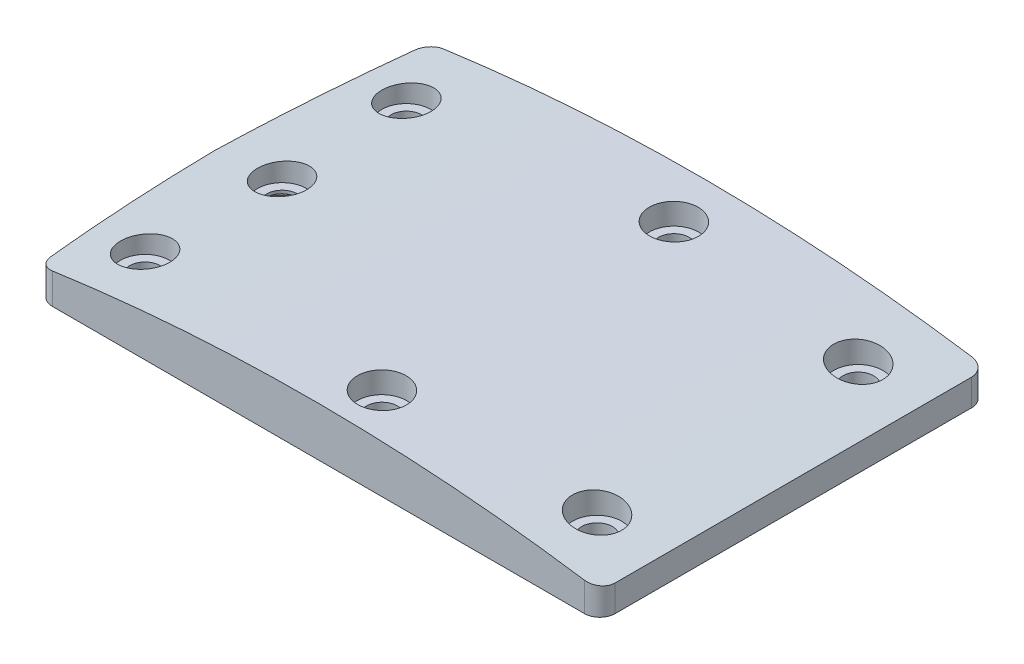
from build123d import *

# Parameters (mm, degrees)
BOSS_EXTRUDE1_DEPTH = 16
CUT_EXTRUDE4_START  = -16
SKETCH5_R           = 5
CUT_EXTRUDE4_DEPTH  = 131.719428883
CUT_EXTRUDE5_DEPTH  = 4
CUT_EXTRUDE6_DEPTH  = 5
CUT_EXTRUDE7_DEPTH  = 5
CUT_EXTRUDE8_DEPTH  = 158.760330048
FILLET1_R           = 3
CUT_EXTRUDE10_START = 5
SKETCH13_R          = 8
CUT_EXTRUDE10_DEPTH = 110.719429035
CUT_EXTRUDE11_START = -9
SKETCH12_R          = 8
CUT_EXTRUDE11_DEPTH = 106.719429035


with BuildPart() as part:
    # Sketch4 → Boss-Extrude1 (new body)
    with BuildSketch(Plane(origin=(0, 0, 0), x_dir=(1, 0, 0), z_dir=(0, 1, 0))):
        with BuildLine():
            Line((88.575219673, 64.406720352), (-83.459577344, 64.406720352))
            ThreePointArc((-83.459577344, 64.406720352), (-86.751538238, 63.170095628), (-88.41513104, 60.071917739))
            ThreePointArc((-88.41513104, 60.071917739), (-91.674518792, 30.098885054), (-93.424780327, 0))
            ThreePointArc((-93.424780327, 0), (-92.220021423, -28.642964058), (-89.549065607, -57.186559296))
            ThreePointArc((-89.549065607, -57.186559296), (-87.903545103, -60.332691249), (-84.584388451, -61.593279648))
            Line((-84.584388451, -61.593279648), (88.575219673, -61.593279648))
            ThreePointArc((88.575219673, -61.593279648), (92.110753579, -60.128813554), (93.575219673, -56.593279648))
            Line((93.575219673, -56.593279648), (93.575219673, 59.406720352))
            ThreePointArc((93.575219673, 59.406720352), (92.110753579, 62.942254258), (88.575219673, 64.406720352))
        make_face()
    extrude(amount=BOSS_EXTRUDE1_DEPTH)

    # Sketch5 → Cut-Extrude4 (cut, through all)
    with BuildSketch(Plane(origin=(0, 0, 0), x_dir=(1, 0, 0), z_dir=(0, 1, 0)).offset(CUT_EXTRUDE4_START)):
        with Locations(Location((73.575219673, -42.5, 0), (0, 0, 90))):
            Circle(SKETCH5_R)
        with Locations(Location((73.575219673, 42.5, 0), (0, 0, 270))):
            Circle(SKETCH5_R)
        with Locations(Location((8.575219673, -47.5, 0), (0, 0, 90))):
            Circle(SKETCH5_R)
        with Locations(Location((8.575219673, 47.5, 0), (0, 0, 270))):
            Circle(SKETCH5_R)
        with Locations(Location((-73.484780327, 42.515, 0), (0, 0, 270))):
            Circle(SKETCH5_R)
        with Locations(Location((-73.484780327, -42.515, 0), (0, 0, 90))):
            Circle(SKETCH5_R)
        with Locations(Location((-71.424780327, 0, 0), (0, 0, 270))):
            Circle(SKETCH5_R)
    extrude(amount=CUT_EXTRUDE4_DEPTH, mode=Mode.SUBTRACT)

    # Sketch7 → Cut-Extrude5 (cut)
    with BuildSketch(Plane.XZ):
        with BuildLine():
            Line((-38.424780327, 46.593279648), (-5.781073413, 46.593279648))
            ThreePointArc((-5.781073413, 46.593279648), (-5.099707526, 46.634894272), (-4.417234862, 46.619984213))
            Line((-4.417234862, 46.619984213), (-4.417234862, -46.500876181))
            ThreePointArc((-4.417234862, -46.500876181), (-5.097555913, -46.570921077), (-5.781073413, -46.594305828))
            Line((-5.781073413, -46.594305828), (-38.424780327, -46.593279648))
            Line((-38.424780327, -46.593279648), (-38.424780327, 46.593279648))
        make_face()
        with BuildLine():
            Line((24.931512758, 46.593279648), (35.575219673, 46.593279648))
            Line((35.575219673, 46.593279648), (35.575219673, -46.593279648))
            Line((35.575219673, -46.593279648), (24.931512758, -46.593279648))
            ThreePointArc((24.931512758, -46.593279648), (20.692833926, -45.650519943), (17.253366215, -43))
            ThreePointArc((17.253366215, -43), (9.575219673, -39.406720352), (1.89707313, -43))
            ThreePointArc((1.89707313, -43), (1.756759775, -43.16451019), (1.612922374, -43.325948235))
            Line((1.612922374, -43.325948235), (1.612922374, 43.395908839))
            ThreePointArc((1.612922374, 43.395908839), (1.757924344, 43.200054886), (1.89707313, 43))
            ThreePointArc((1.89707313, 43), (9.036311071, 39.460408221), (15.724058142, 43.793013381))
            ThreePointArc((15.724058142, 43.793013381), (19.738142609, 47.131929893), (24.931512758, 46.593279648))
        make_face()
        with BuildLine():
            Line((41.575219673, 46.593279648), (56.164620976, 46.593279648))
            ThreePointArc((56.164620976, 46.593279648), (61.684258486, 44.931960704), (65.369920324, 40.5))
            ThreePointArc((65.369920324, 40.5), (66.975342242, 37.230412227), (69.808412923, 34.941024917))
            ThreePointArc((69.808412923, 34.941024917), (73.840624852, 31.532753856), (75.575219673, 26.546149253))
            Line((75.575219673, 26.546149253), (75.575219673, -26.546149253))
            ThreePointArc((75.575219673, -26.546149253), (74.089912856, -31.790193493), (70.075219673, -35.476434802))
            ThreePointArc((70.075219673, -35.476434802), (67.276736311, -37.570629318), (65.369920324, -40.5))
            ThreePointArc((65.369920324, -40.5), (61.684258486, -44.931960704), (56.164620976, -46.593279648))
            Line((56.164620976, -46.593279648), (41.575219673, -46.593279648))
            Line((41.575219673, -46.593279648), (41.575219673, 46.593279648))
        make_face()
        with BuildLine():
            Line((-54.743486484, 46.593279648), (-44.424780327, 46.593279648))
            Line((-44.424780327, 46.593279648), (-44.424780327, -46.593279648))
            Line((-44.424780327, -46.593279648), (-54.743486484, -46.593279648))
            ThreePointArc((-54.743486484, -46.593279648), (-61.155152403, -44.267296858), (-64.584133405, -38.371387676))
            ThreePointArc((-64.584133405, -38.371387676), (-66.412168434, -34.166348485), (-69.924780327, -31.219210154))
            ThreePointArc((-69.924780327, -31.219210154), (-73.93947351, -27.532968845), (-75.424780327, -22.288924605))
            Line((-75.424780327, -22.288924605), (-75.424780327, -14.282856857))
            ThreePointArc((-75.424780327, -14.282856857), (-76.20523587, -10.409873511), (-78.424780327, -7.141428429))
            ThreePointArc((-78.424780327, -7.141428429), (-81.424780327, 0), (-78.424780327, 7.141428429))
            ThreePointArc((-78.424780327, 7.141428429), (-76.20523587, 10.409873511), (-75.424780327, 14.282856857))
            Line((-75.424780327, 14.282856857), (-75.929260945, 22.200005063))
            ThreePointArc((-75.929260945, 22.200005063), (-74.815535577, 28.805043182), (-69.782925125, 33.225421535))
            ThreePointArc((-69.782925125, 33.225421535), (-66.616240775, 35.247045376), (-64.419040668, 38.294530307))
            ThreePointArc((-64.419040668, 38.294530307), (-60.479009071, 43.490591029), (-54.743486484, 46.593279648))
        make_face()
    extrude(amount=-CUT_EXTRUDE5_DEPTH, mode=Mode.SUBTRACT)

    # Sketch9 → Cut-Extrude6 (cut)
    with BuildSketch(Plane.XZ):
        with BuildLine():
            Line((-38.424780327, 46.593279648), (-38.424780327, -46.593279648))
            Line((-38.424780327, -46.593279648), (-5.781073413, -46.594305828))
            ThreePointArc((-5.781073413, -46.594305828), (-5.097555913, -46.570921077), (-4.417234862, -46.500876181))
            Line((-4.417234862, -46.500876181), (-4.417234862, 46.619984213))
            ThreePointArc((-4.417234862, 46.619984213), (-5.099707526, 46.634894272), (-5.781073413, 46.593279648))
            Line((-5.781073413, 46.593279648), (-38.424780327, 46.593279648))
        make_face()
    extrude(amount=-CUT_EXTRUDE6_DEPTH, mode=Mode.SUBTRACT)

    # Sketch10 → Cut-Extrude7 (cut)
    with BuildSketch(Plane.XZ):
        with BuildLine():
            Line((1.612922374, 43.395908839), (1.612922374, -43.325948235))
            ThreePointArc((1.612922374, -43.325948235), (1.756759775, -43.16451019), (1.89707313, -43))
            ThreePointArc((1.89707313, -43), (9.575219673, -39.406720352), (17.253366215, -43))
            ThreePointArc((17.253366215, -43), (20.692833926, -45.650519943), (24.931512758, -46.593279648))
            Line((24.931512758, -46.593279648), (35.575219673, -46.593279648))
            Line((35.575219673, -46.593279648), (35.575219673, 46.593279648))
            Line((35.575219673, 46.593279648), (24.931512758, 46.593279648))
            ThreePointArc((24.931512758, 46.593279648), (19.738142609, 47.131929893), (15.724058142, 43.793013381))
            ThreePointArc((15.724058142, 43.793013381), (9.036311071, 39.460408221), (1.89707313, 43))
            ThreePointArc((1.89707313, 43), (1.757924344, 43.200054886), (1.612922374, 43.395908839))
        make_face()
    extrude(amount=-CUT_EXTRUDE7_DEPTH, mode=Mode.SUBTRACT)

    # Sketch11 → Cut-Extrude8 (cut, through all)
    with BuildSketch(Plane.XY.offset(61.593279648)):
        with BuildLine():
            Line((-84.584388451, 16), (-103.364147051, 16))
            Line((-103.364147051, 16), (-103.364147051, 7.029485816))
            ThreePointArc((-103.364147051, 7.029485816), (-93.986067358, 8.593131198), (-84.584388451, 10.00798078))
            Line((-84.584388451, 10.00798078), (-84.584388451, 16))
        make_face()
        with BuildLine():
            Line((0, 16), (-84.584388451, 16))
            Line((-84.584388451, 16), (-84.584388451, 10.00798078))
            ThreePointArc((-84.584388451, 10.00798078), (-42.398181164, 14.500120496), (0, 16))
        make_face()
        with BuildLine():
            Line((102.943098183, 16), (88.575219673, 16))
            Line((88.575219673, 16), (88.575219673, 9.42601094))
            ThreePointArc((88.575219673, 9.42601094), (95.766203072, 8.308056968), (102.943098183, 7.102967795))
            Line((102.943098183, 7.102967795), (102.943098183, 16))
        make_face()
        with BuildLine():
            Line((88.575219673, 16), (0, 16))
            ThreePointArc((0, 16), (44.409421501, 14.354245645), (88.575219673, 9.42601094))
            Line((88.575219673, 9.42601094), (88.575219673, 16))
        make_face()
    extrude(amount=-CUT_EXTRUDE8_DEPTH, mode=Mode.SUBTRACT)

    # Fillet1
    # the kernel refuses this fillet: 3 mm, written as the material it adds along each edge
    with BuildSketch(Plane(origin=(-44.424780327, 0, 46.593279648), x_dir=(0, 0, -1), z_dir=(0, 1, 0)), Plane(origin=(41.575219673, 0, -46.593279648), x_dir=(0, 0, 1), z_dir=(0, 1, 0)), Plane(origin=(-44.424780327, 0, -46.593279648), x_dir=(-1, 0, 0), z_dir=(0, 1, 0))) as fillet1_piece_1:
        with BuildLine():
            CenterArc((FILLET1_R, FILLET1_R), FILLET1_R, 180, 90)
            Line((0, FILLET1_R), (-FILLET1_R * 0.02, FILLET1_R))
            Line((-FILLET1_R * 0.02, FILLET1_R), (-FILLET1_R * 0.02, -FILLET1_R * 0.02))
            Line((-FILLET1_R * 0.02, -FILLET1_R * 0.02), (FILLET1_R, -FILLET1_R * 0.02))
            Line((FILLET1_R, -FILLET1_R * 0.02), (FILLET1_R, 0))
        make_face()
    extrude(amount=11.5)
    with BuildSketch(Plane(origin=(41.575219673, 0, 46.593279648), x_dir=(0, 0, -1), z_dir=(0, 1, 0))) as fillet1_piece_2:
        with BuildLine():
            CenterArc((FILLET1_R, -FILLET1_R), FILLET1_R, 90, 90)
            Line((0, -FILLET1_R), (-FILLET1_R * 0.02, -FILLET1_R))
            Line((-FILLET1_R * 0.02, -FILLET1_R), (-FILLET1_R * 0.02, FILLET1_R * 0.02))
            Line((-FILLET1_R * 0.02, FILLET1_R * 0.02), (FILLET1_R, FILLET1_R * 0.02))
            Line((FILLET1_R, FILLET1_R * 0.02), (FILLET1_R, 0))
        make_face()
    extrude(amount=11.5)
    with BuildSketch(Plane(origin=(35.575219673, 12.5, 46.593279648), x_dir=(0, 0, -1), z_dir=(0, -1, 0)), Plane(origin=(-38.424780327, 0, 46.593279648), x_dir=(0, 0, -1), z_dir=(0, 1, 0)), Plane(origin=(35.575219673, 12.5, -46.593279648), x_dir=(-1, 0, 0), z_dir=(0, -1, 0))) as fillet1_piece_3:
        with BuildLine():
            CenterArc((FILLET1_R, -FILLET1_R), FILLET1_R, 90, 90)
            Line((0, -FILLET1_R), (-FILLET1_R * 0.02, -FILLET1_R))
            Line((-FILLET1_R * 0.02, -FILLET1_R), (-FILLET1_R * 0.02, FILLET1_R * 0.02))
            Line((-FILLET1_R * 0.02, FILLET1_R * 0.02), (FILLET1_R, FILLET1_R * 0.02))
            Line((FILLET1_R, FILLET1_R * 0.02), (FILLET1_R, 0))
        make_face()
    extrude(amount=12.5)
    with BuildSketch(Plane(origin=(-4.417234862, 11.353143378, 46.619984213), x_dir=(0, 0, -1), z_dir=(0, -1, 0))) as fillet1_piece_4:
        with BuildLine():
            CenterArc((2.541257351, -3), FILLET1_R, 90, 56.948875944)
            Line((0.026704565, -1.363838551), (-0.02358649, -1.331115322))
            ThreePointArc((-0.02358649, -1.331115322), (-0.07489856, -0.683647266), (-0.059879965, 0.003793382))
            Line((-0.059879965, 0.003793382), (0, 0.06))
            Line((0, 0.06), (2.541257351, 0.06))
            Line((2.541257351, 0.06), (2.541257351, 0))
        make_face()
    extrude(amount=11.353143378)
    with BuildSketch(Plane(origin=(-38.424780327, 12.499764235, -46.593279648), x_dir=(0, 0, 1), z_dir=(0, -1, 0))) as fillet1_piece_5:
        with BuildLine():
            CenterArc((FILLET1_R * 0.999968564716, -FILLET1_R), FILLET1_R, 90, 89.998198863)
            Line((-FILLET1_R * 3.14347899983e-05, -FILLET1_R * 0.999968564222), (-FILLET1_R * 0.0200314347801, -FILLET1_R * 0.999967935506))
            Line((-FILLET1_R * 0.0200314347801, -FILLET1_R * 0.999967935506), (-FILLET1_R * 0.0199993712943, FILLET1_R * 0.02))
            Line((-FILLET1_R * 0.0199993712943, FILLET1_R * 0.02), (FILLET1_R * 0.999968564716, FILLET1_R * 0.02))
            Line((FILLET1_R * 0.999968564716, FILLET1_R * 0.02), (FILLET1_R * 0.999968564716, 0))
        make_face()
    extrude(amount=12.499764235)
    with BuildSketch(Plane(origin=(-4.417234862, 12.503867896, -46.500876181), x_dir=(-0.9995159659973953, 0, -0.03111002597706551), z_dir=(0, -1, 0))) as fillet1_piece_6:
        with BuildLine():
            CenterArc((2.908122819, -2.998544963), FILLET1_R, 88.215438025, 90.001801137)
            Line((-0.090425079, -2.905214885), (-0.390279869, -2.895881877))
            Line((-0.390279869, -2.895881877), (-0.29985479, 0.009333008))
            Line((-0.29985479, 0.009333008), (-0.031645337, 0.298326286))
            ThreePointArc((-0.031645337, 0.298326286), (1.375427439, 0.350809867), (3.010889592, 0.299854496))
            Line((3.010889592, 0.299854496), (3.001547158, 0))
        make_face()
    extrude(amount=12.503867896)

    # Sketch13 → Cut-Extrude10 (cut, through all)
    with BuildSketch(Plane(origin=(0, 0, 0), x_dir=(1, 0, 0), z_dir=(0, 1, 0)).offset(CUT_EXTRUDE10_START)):
        with Locations(Location((-73.484780327, -42.515, 0), (0, 0, 90))):
            Circle(SKETCH13_R)
        with Locations(Location((-73.484780327, 42.515, 0), (0, 0, 90))):
            Circle(SKETCH13_R)
        with Locations(Location((-71.424780327, 0, 0), (0, 0, 90))):
            Circle(SKETCH13_R)
        with Locations(Location((73.575219673, 42.5, 0), (0, 0, 90))):
            Circle(SKETCH13_R)
        with Locations(Location((73.575219673, -42.5, 0), (0, 0, 90))):
            Circle(SKETCH13_R)
    extrude(amount=CUT_EXTRUDE10_DEPTH, mode=Mode.SUBTRACT)

    # Sketch12 → Cut-Extrude11 (cut, through all)
    with BuildSketch(Plane.XZ.offset(CUT_EXTRUDE11_START)):
        with Locations(Location((8.575219673, 47.5, 0), (0, 0, 270))):
            Circle(SKETCH12_R)
        with Locations(Location((8.575219673, -47.5, 0), (0, 0, 270))):
            Circle(SKETCH12_R)
    extrude(amount=-CUT_EXTRUDE11_DEPTH, mode=Mode.SUBTRACT)


solid = part.part
